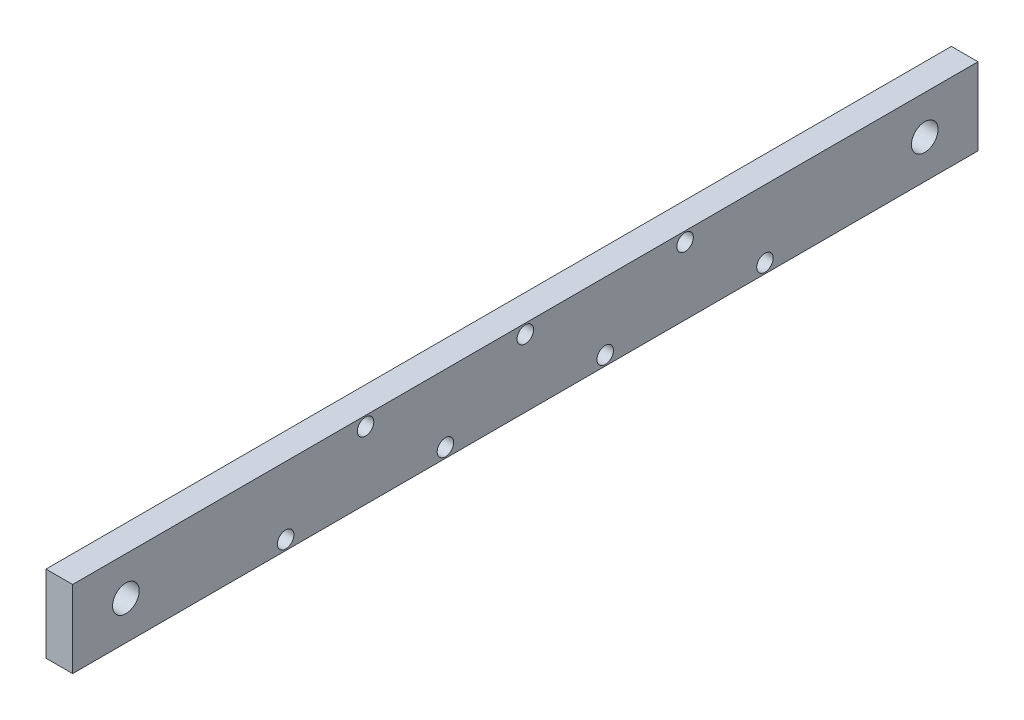
from build123d import *

# Parameters (mm, degrees)
SKETCH_1_W          = 340
SKETCH_1_H          = 29
EXTRUDE_1_DEPTH     = 10
SKETCH_1_3_R        = 3.1
CUT_EXTRUDE_1_DEPTH = 171.910064069
SKETCH_1_4_R        = 5
CUT_EXTRUDE_2_DEPTH = 171.910064069


with BuildPart() as part:
    # 草图1 → 凸台-拉伸1 (new body)
    with BuildSketch(Plane(origin=(0, 0, 0), x_dir=(0, 0, -1), z_dir=(1, 0, 0))):
        Rectangle(SKETCH_1_W, SKETCH_1_H)
    extrude(amount=EXTRUDE_1_DEPTH)

    # 草图1<3> → 切除-拉伸1 (cut, through all)
    with BuildSketch(Plane(origin=(0, 0, 0), x_dir=(0, 0, -1), z_dir=(1, 0, 0))):
        with Locations((-90, -10.858617882)):
            Circle(SKETCH_1_3_R)
        with Locations((-30, -10.858617882)):
            Circle(SKETCH_1_3_R)
        with Locations((30, -10.858617882)):
            Circle(SKETCH_1_3_R)
        with Locations((-60, 10.858617882)):
            Circle(SKETCH_1_3_R)
        with Locations((90, -10.858617882)):
            Circle(SKETCH_1_3_R)
        with Locations((0, 10.858617882)):
            Circle(SKETCH_1_3_R)
        with Locations((60, 10.858617882)):
            Circle(SKETCH_1_3_R)
    extrude(amount=CUT_EXTRUDE_1_DEPTH, mode=Mode.SUBTRACT)

    # 草图1<4> → 切除-拉伸2 (cut, through all)
    with BuildSketch(Plane(origin=(0, 0, 0), x_dir=(0, 0, -1), z_dir=(1, 0, 0))):
        with Locations((-150, 0)):
            Circle(SKETCH_1_4_R)
        with Locations((150, 0)):
            Circle(SKETCH_1_4_R)
    extrude(amount=CUT_EXTRUDE_2_DEPTH, mode=Mode.SUBTRACT)


solid = part.part
